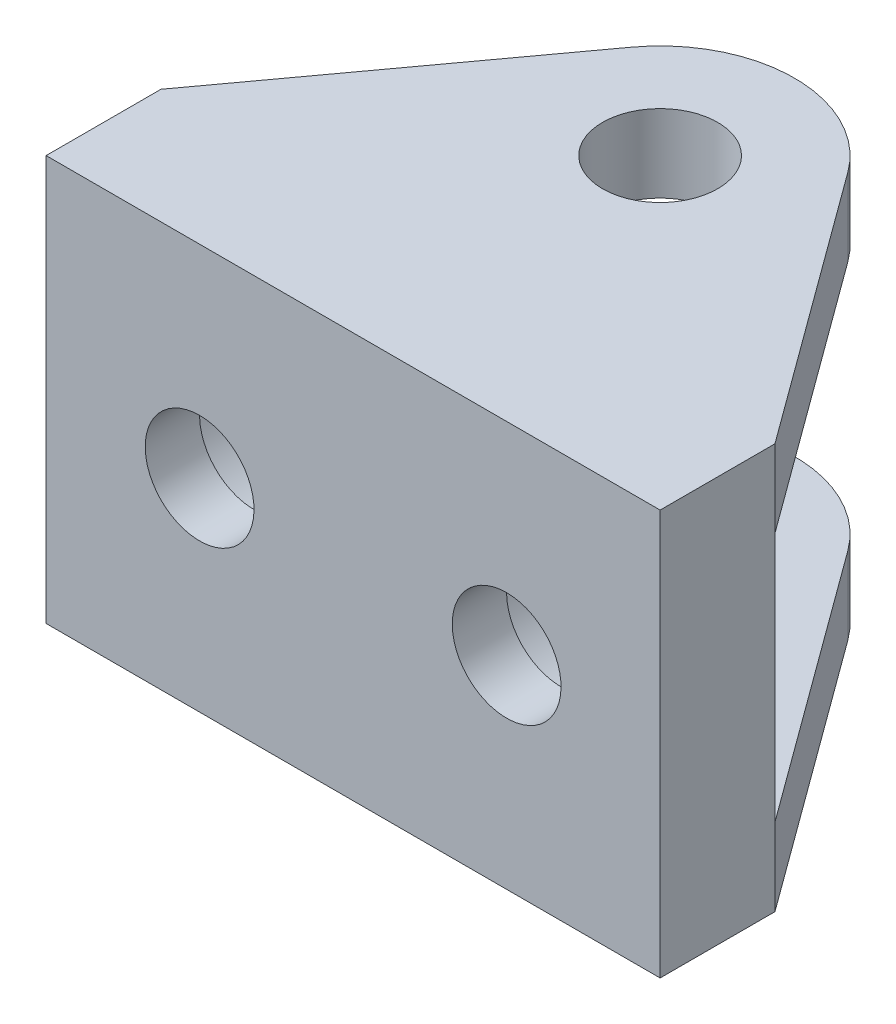
from build123d import *

# Parameters (mm, degrees)
SKETCH1_R                               = 4.7625
BOSS_EXTRUDE1_DEPTH                     = 33.528
CUT_EXTRUDE1_DEPTH                      = 71.978373046
CBORE_FOR_M8_HEX_HEAD_BOLT1_D           = 9
CBORE_FOR_M8_HEX_HEAD_BOLT1_CBORE_D     = 16
CBORE_FOR_M8_HEX_HEAD_BOLT1_CBORE_DEPTH = 5


with BuildPart() as part:
    # Sketch1 → Boss-Extrude1 (new body)
    with BuildSketch(Plane(origin=(0, 0, 0), x_dir=(1, 0, 0), z_dir=(0, 1, 0))):
        with BuildLine():
            Line((0, 0), (50.8, 0))
            Line((50.8, 0), (50.8, 9.4996))
            Line((50.8, 9.4996), (34.368896597, 31.960986975))
            ThreePointArc((34.368896597, 31.960986975), (25.4, 36.5125), (16.431103403, 31.960986975))
            Line((16.431103403, 31.960986975), (0, 9.4996))
            Line((0, 9.4996), (0, 0))
        make_face()
        with Locations((25.4, 25.4)):
            Circle(SKETCH1_R, mode=Mode.SUBTRACT)
    extrude(amount=BOSS_EXTRUDE1_DEPTH)

    # Sketch2 → Cut-Extrude1 (cut, through all)
    with BuildSketch(Plane(origin=(50.8, 0, 0), x_dir=(0, 0, -1), z_dir=(1, 0, 0))):
        Polygon((9.4996, 16.764), (9.4996, 27.1145), (41.2496, 27.1145), (41.2496, 6.4135), (9.4996, 6.4135), align=None)
    extrude(amount=-CUT_EXTRUDE1_DEPTH, mode=Mode.SUBTRACT)

    # CBORE for M8 Hex Head Bolt1 (through all)
    with Locations(Plane(origin=(0, 0, -9.4996), x_dir=(-1, 0, 0), z_dir=(0, 0, -1))):
        with Locations((-12.7, 16.764), (-38.1, 16.764)):
            CounterBoreHole(CBORE_FOR_M8_HEX_HEAD_BOLT1_D / 2, CBORE_FOR_M8_HEX_HEAD_BOLT1_CBORE_D / 2, CBORE_FOR_M8_HEX_HEAD_BOLT1_CBORE_DEPTH)


solid = part.part
